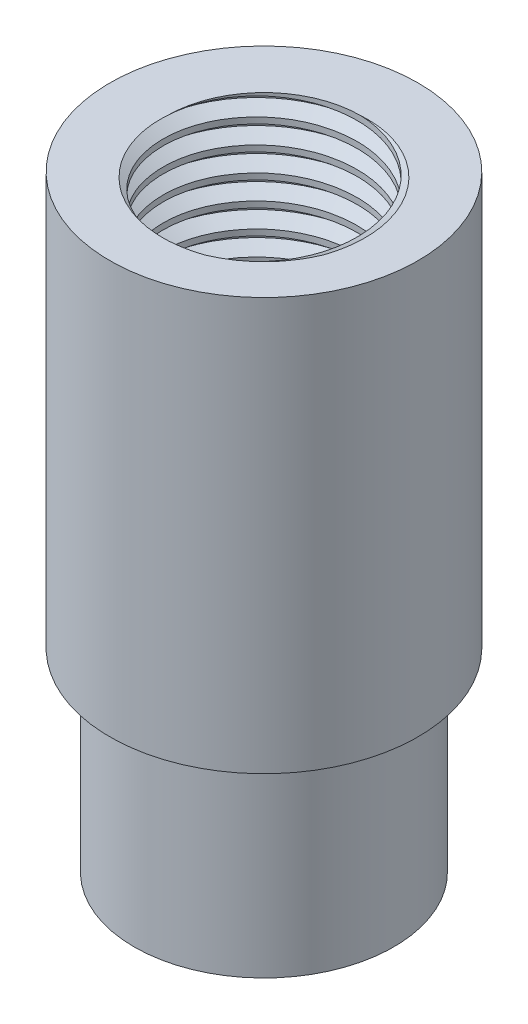
from build123d import *

# Parameters (mm, degrees)
THREAD1_PITCH = 1


with BuildPart() as part:
    # Sketch1 → Revolve1 (revolve)
    with BuildSketch(Plane.XY, mode=Mode.PRIVATE) as revolve1_sk:
        Polygon((0, 10), (0, 0), (5.35, 0), (5.35, 8), (6.35, 8), (6.35, 25), (4, 25), (4, 10), align=None)
    revolve(revolve1_sk.sketch.rotate(Axis((0, 0, 0), (0, 1, 0)), 90), axis=Axis((0, 0, 0), (0, 1, 0)))

    # Thread1: the profile of Thread Profile1 profile screwed along a right-hand helix of 17 turns, 8 arcs to a turn; built about Z, then put on its axis
    thread1_z = Axis((0, 0, 0), (0, 0, 1))
    thread1_corners = [(3.9997, 0, -0.000173205), (4.541265875, 0, 0.312499999), (4.541265875, 0, 0.437499999), (3.9997, 0, 0.750173202)]
    with BuildLine(mode=Mode.PRIVATE) as thread1_profile:
        Line(thread1_corners[0], thread1_corners[1])
        Line(thread1_corners[1], thread1_corners[2])
        Line(thread1_corners[2], thread1_corners[3])
        Line(thread1_corners[3], thread1_corners[0])
    thread1_cap = Face(thread1_profile.wire())
    thread1_turn_angles = [0, 22.5, 45, 67.5, 90, 112.5, 135, 157.5, 180, 202.5, 225, 247.5, 270, 292.5, 315, 337.5, 360]
    thread1_turn_weights = [1, 0.9238795325112867, 1, 0.9238795325112867, 1, 0.9238795325112867, 1, 0.9238795325112867, 1, 0.9238795325112867, 1, 0.9238795325112867, 1, 0.9238795325112867, 1, 0.9238795325112867, 1]
    thread1_turn_rails = [Edge.make_bspline([Vector(p[0], p[1], 0).rotate(thread1_z, thread1_turn_angles[k]) / thread1_turn_weights[k] + Vector(0, 0, p[2] + THREAD1_PITCH * thread1_turn_angles[k] / 360) for k in range(17)], [0, 0, 0, 1, 1, 2, 2, 3, 3, 4, 4, 5, 5, 6, 6, 7, 7, 8, 8, 8], 2, thread1_turn_weights) for p in thread1_corners]
    thread1_turn_sides = [Face.make_surface_from_curves(thread1_turn_rails[p[0]], thread1_turn_rails[p[1]]) for p in [(0, 1), (1, 2), (2, 3), (3, 0)]]
    thread1 = Plane(origin=(0, 27, 0), x_dir=(-1, 0, 0), z_dir=(0, -1, 0)) * Solid(Shell([*[p.moved(Location((0, 0, THREAD1_PITCH * i))) for i in range(17) for p in thread1_turn_sides], thread1_cap, thread1_cap.rotate(thread1_z, 6120).moved(Location((0, 0, THREAD1_PITCH * 6120 / 360)))]))
    add(thread1, mode=Mode.SUBTRACT)


solid = part.part
